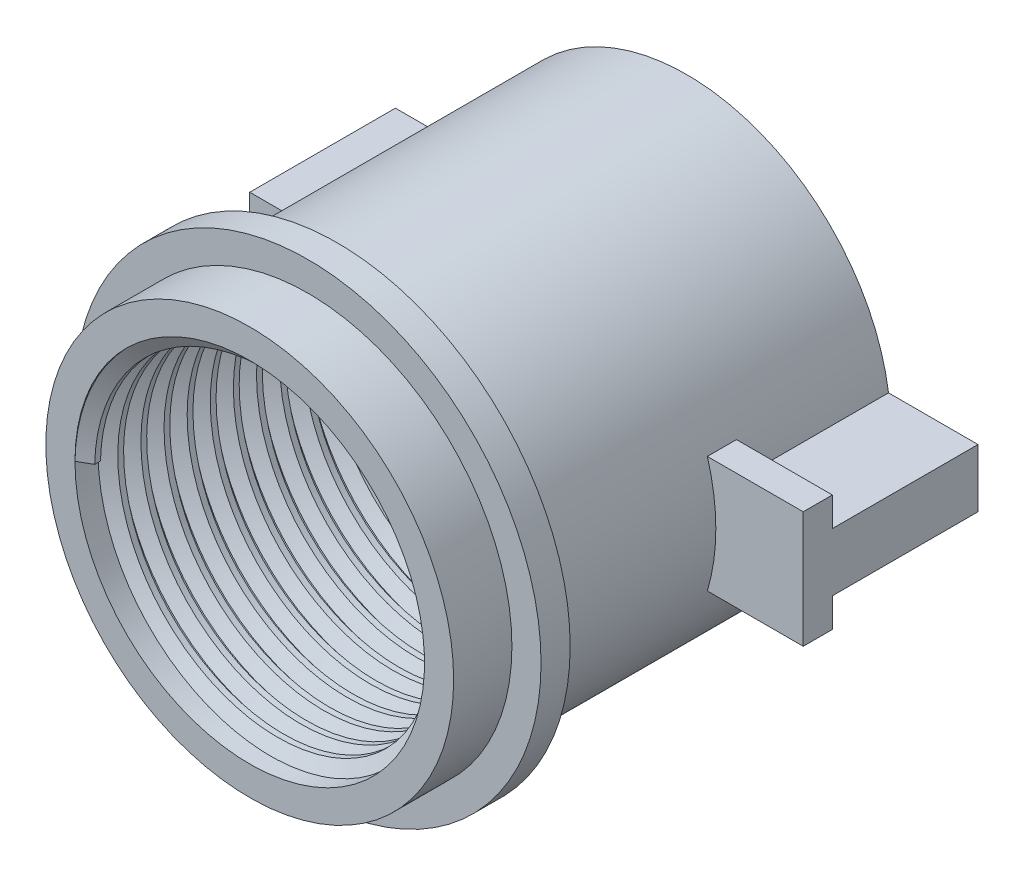
from build123d import *

# Parameters (mm, degrees)
ESQUISSE1_R             = 7
BOSS_EXTRU_1_DEPTH      = 15
COQUE1_T                = -1
ESQUISSE2_R             = 2.75
ENL_V_MAT_EXTRU_1_DEPTH = 15
CHANFREIN1_SIZE         = 3
FILETAGE1_PITCH         = 0.79375
BOSS_EXTRU_2_DEPTH      = 5
BOSS_EXTRU_3_DEPTH      = 1
BOSS_EXTRU_4_START      = -3
ESQUISSE5_R             = 8
ESQUISSE5_R_2           = 7
BOSS_EXTRU_4_DEPTH      = 1


with BuildPart() as part:
    # Esquisse1 → Boss.-Extru.1 (new body)
    with BuildSketch(Plane.XY):
        Circle(ESQUISSE1_R)
    extrude(amount=BOSS_EXTRU_1_DEPTH)

    # Coque1
    coque1_openings = [part.faces().sort_by_distance(p)[0] for p in [
        (0, 0, 15),
    ]]
    offset(amount=COQUE1_T, openings=coque1_openings, kind=Kind.INTERSECTION)

    # Esquisse2 → Enlèv. mat.-Extru.1 (cut)
    with BuildSketch(Plane(origin=(0, 0, 0), x_dir=(-1, 0, 0), z_dir=(0, 0, -1))):
        Circle(ESQUISSE2_R)
    extrude(amount=-ENL_V_MAT_EXTRU_1_DEPTH, mode=Mode.SUBTRACT)

    # Chanfrein1
    chanfrein1_edges = [part.edges().sort_by_distance(p)[0] for p in [
        (-6, 0, 1),
    ]]
    chamfer(chanfrein1_edges, length=CHANFREIN1_SIZE)

    # Filetage1: the profile of Profil de filetage1 profile screwed along a right-hand helix of 10.07874 turns, 8 arcs to a turn; built about Z, then put on its axis
    filetage1_z = Axis((0, 0, 0), (0, 0, 1))
    filetage1_corners = [(6.0003, 0, -0.000173205), (6.0003, 0, 0.694704453), (5.570370212, 0, 0.446484374), (5.570370212, 0, 0.248046874)]
    with BuildLine(mode=Mode.PRIVATE) as filetage1_profile:
        Line(filetage1_corners[0], filetage1_corners[1])
        Line(filetage1_corners[1], filetage1_corners[2])
        Line(filetage1_corners[2], filetage1_corners[3])
        Line(filetage1_corners[3], filetage1_corners[0])
    filetage1_cap = Face(filetage1_profile.wire())
    filetage1_turn_angles = [0, 22.5, 45, 67.5, 90, 112.5, 135, 157.5, 180, 202.5, 225, 247.5, 270, 292.5, 315, 337.5, 360]
    filetage1_turn_weights = [1, 0.9238795325112867, 1, 0.9238795325112867, 1, 0.9238795325112867, 1, 0.9238795325112867, 1, 0.9238795325112867, 1, 0.9238795325112867, 1, 0.9238795325112867, 1, 0.9238795325112867, 1]
    filetage1_turn_rails = [Edge.make_bspline([Vector(p[0], p[1], 0).rotate(filetage1_z, filetage1_turn_angles[k]) / filetage1_turn_weights[k] + Vector(0, 0, p[2] + FILETAGE1_PITCH * filetage1_turn_angles[k] / 360) for k in range(17)], [0, 0, 0, 1, 1, 2, 2, 3, 3, 4, 4, 5, 5, 6, 6, 7, 7, 8, 8, 8], 2, filetage1_turn_weights) for p in filetage1_corners]
    filetage1_turn_sides = [Face.make_surface_from_curves(filetage1_turn_rails[p[0]], filetage1_turn_rails[p[1]]) for p in [(0, 1), (1, 2), (2, 3), (3, 0)]]
    filetage1_last_angles = [3600, 3614.173228346, 3628.346456693]
    filetage1_last_weights = [1, 0.9695598647982457, 1]
    filetage1_last_rails = [Edge.make_bspline([Vector(p[0], p[1], 0).rotate(filetage1_z, filetage1_last_angles[k]) / filetage1_last_weights[k] + Vector(0, 0, p[2] + FILETAGE1_PITCH * filetage1_last_angles[k] / 360) for k in range(3)], [0, 0, 0, 1, 1, 1], 2, filetage1_last_weights) for p in filetage1_corners]
    filetage1_last_sides = [Face.make_surface_from_curves(filetage1_last_rails[p[0]], filetage1_last_rails[p[1]]) for p in [(0, 1), (1, 2), (2, 3), (3, 0)]]
    filetage1 = Plane(origin=(0, 0, 15), x_dir=(-1, 0, 0), z_dir=(0, 0, -1)) * Solid(Shell([*[p.moved(Location((0, 0, FILETAGE1_PITCH * i))) for i in range(10) for p in filetage1_turn_sides], *filetage1_last_sides, filetage1_cap, filetage1_cap.rotate(filetage1_z, 3628.346456693).moved(Location((0, 0, FILETAGE1_PITCH * 3628.346456693 / 360)))]))
    add(filetage1)

    # Esquisse3 → Boss.-Extru.2 (add)
    with BuildSketch(Plane(origin=(0, 0, 0), x_dir=(-1, 0, 0), z_dir=(0, 0, -1))):
        with BuildLine():
            Line((-6.92820323, 1), (-10, 1))
            Line((-10, 1), (-10, -1))
            Line((-10, -1), (-6.92820323, -1))
            ThreePointArc((-6.92820323, -1), (-7, 0), (-6.92820323, 1))
        make_face()
        with BuildLine():
            Line((10, -1), (6.92820323, -1))
            ThreePointArc((6.92820323, -1), (7, 0), (6.92820323, 1))
            Line((6.92820323, 1), (10, 1))
            Line((10, 1), (10, -1))
        make_face()
    extrude(amount=-BOSS_EXTRU_2_DEPTH)

    # Esquisse4 → Boss.-Extru.3 (add)
    with BuildSketch(Plane.XY.offset(5)):
        with BuildLine():
            Line((10, 2), (10, -2))
            Line((10, -2), (6.708203932, -2))
            ThreePointArc((6.708203932, -2), (7, 0), (6.708203932, 2))
            Line((6.708203932, 2), (10, 2))
        make_face()
    extrude(amount=BOSS_EXTRU_3_DEPTH)

    # Esquisse5 → Boss.-Extru.4 (add)
    with BuildSketch(Plane.XY.offset(15).offset(BOSS_EXTRU_4_START)):
        Circle(ESQUISSE5_R)
        with Locations(Location((0, 0, 0), (0, 0, 171.786789298))):
            Circle(ESQUISSE5_R_2, mode=Mode.SUBTRACT)
    extrude(amount=BOSS_EXTRU_4_DEPTH)


solid = part.part
